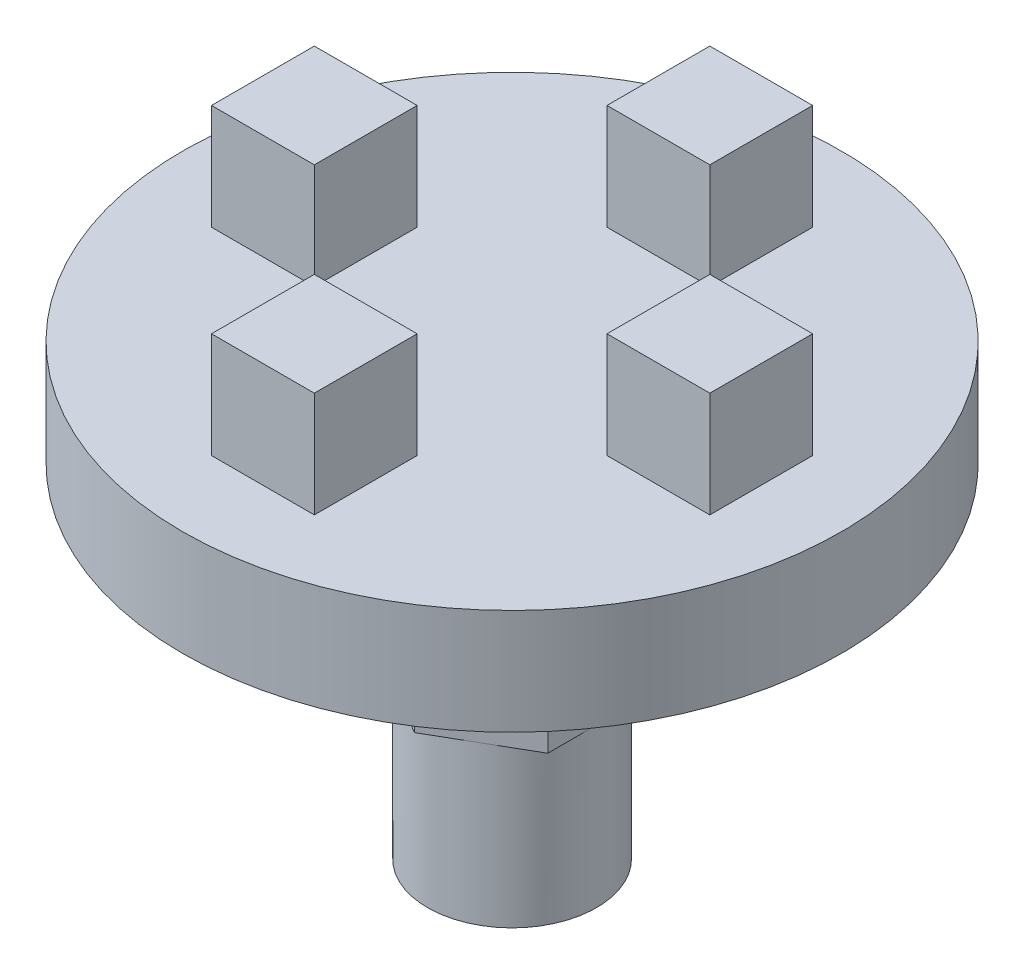
from build123d import *

# Parameters (mm, degrees)
SKETCH1_R           = 12.5
BOSS_EXTRUDE1_DEPTH = 2
SKETCH2_W           = 3.9
SKETCH2_H           = 3.9
BOSS_EXTRUDE3_DEPTH = 4
SKETCH3_R           = 5
BOSS_EXTRUDE4_DEPTH = 1
BOSS_EXTRUDE5_DEPTH = 6
SKETCH5_R           = 3.204293994
BOSS_EXTRUDE6_DEPTH = 6


with BuildPart() as part:
    # Sketch1 → Boss-Extrude1 (new, symmetric)
    with BuildSketch(Plane(origin=(0, 0, 0), x_dir=(1, 0, 0), z_dir=(0, 1, 0))):
        Circle(SKETCH1_R)
    extrude(amount=BOSS_EXTRUDE1_DEPTH, both=True)

    # Sketch2 → Boss-Extrude3 (add)
    with BuildSketch(Plane(origin=(0, 2, 0), x_dir=(1, 0, 0), z_dir=(0, 1, 0))):
        with Locations((0, 7.5)):
            Rectangle(SKETCH2_W, SKETCH2_H)
        with Locations((7.5, 0)):
            Rectangle(SKETCH2_W, SKETCH2_H)
        with Locations((0, -7.5)):
            Rectangle(SKETCH2_W, SKETCH2_H)
        with Locations((-7.5, 0)):
            Rectangle(SKETCH2_W, SKETCH2_H)
    extrude(amount=BOSS_EXTRUDE3_DEPTH)

    # Sketch3 → Boss-Extrude4 (add)
    with BuildSketch(Plane.XZ.offset(2)):
        Circle(SKETCH3_R)
    extrude(amount=BOSS_EXTRUDE4_DEPTH)

    # Sketch4 → Boss-Extrude5 (add)
    with BuildSketch(Plane.XZ.offset(3)):
        Polygon((0, -3.7), (3.204293994, -1.85), (3.204293994, 1.85), (0, 3.7), (-3.204293994, 1.85), (-3.204293994, -1.85), align=None)
    extrude(amount=BOSS_EXTRUDE5_DEPTH)

    # Sketch5 → Boss-Extrude6 (add)
    with BuildSketch(Plane(origin=(0, -9, 0), x_dir=(-1, 0, 0), z_dir=(0, -1, 0))):
        Circle(SKETCH5_R)
    extrude(amount=BOSS_EXTRUDE6_DEPTH)


solid = part.part
